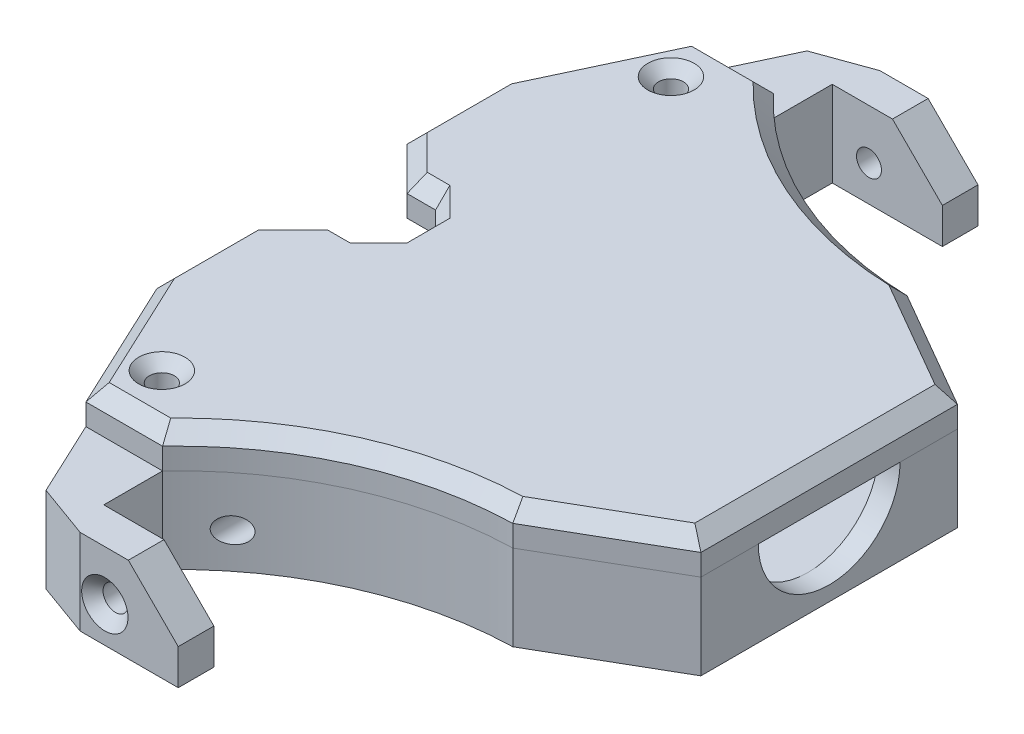
from build123d import *
from OCP.BRepFilletAPI import BRepFilletAPI_MakeChamfer

# Parameters (mm, degrees)
BOSS_EXTRUDE1_DEPTH     = 2
BOSS_EXTRUDE2_DEPTH     = 10
BOSS_EXTRUDE3_START     = -10
BOSS_EXTRUDE3_DEPTH     = 10
SKETCH4_4_W             = 12.534166667
SKETCH4_4_H             = 17.5
CUT_EXTRUDE3_DEPTH      = 10
CUT_EXTRUDE4_DEPTH      = 112.520919575
CHAMFER1_SIZE           = 3
CHAMFER1_SIZE2          = 8.242432258
BOSS_EXTRUDE4_DEPTH     = 19.55
SKETCH9_W               = 19.55
SKETCH9_H               = 12
BOSS_EXTRUDE5_DEPTH     = 8.25
SKETCH10_W              = 19.55
SKETCH10_H              = 12
BOSS_EXTRUDE6_DEPTH     = 8.25
SKETCH11_W              = 35
SKETCH11_H              = 12
BOSS_EXTRUDE7_DEPTH     = 5
SKETCH12_W              = 35
SKETCH12_H              = 12
BOSS_EXTRUDE8_DEPTH     = 5
CUT_EXTRUDE6_DEPTH      = 112.897788575
CHAMFER2_SIZE           = 3
CHAMFER2_SIZE2          = 6.236681311
CHAMFER3_SIZE           = 7
CUT_EXTRUDE7_DEPTH      = 120.143501803
CUT_EXTRUDE7_DEPTH_BACK = 120.143501803
SKETCH14_R              = 1.75
CUT_EXTRUDE8_REACH      = 110.526
SKETCH15_R              = 1.5
CHAMFER5_SIZE           = 1
CUT_EXTRUDE9_DEPTH      = 3
BOSS_EXTRUDE9_DEPTH     = 5
CHAMFER6_SIZE           = 2
CUT_EXTRUDE10_START     = -17
SKETCH18_R              = 1.75
CUT_EXTRUDE10_DEPTH     = 17
CHAMFER7_SIZE           = 1.5
SKETCH23_R              = 1.75
CUT_EXTRUDE15_DEPTH     = 2.35
CUT_EXTRUDE16_START     = -5
CUT_EXTRUDE16_OUTLINE_W = 12
CUT_EXTRUDE16_OUTLINE_H = 10
CUT_EXTRUDE16_DEPTH     = 5
CHAMFER8_SIZE           = 2
CHAMFER11_SIZE          = 1.5
CUT_EXTRUDE17_DEPTH     = 2.4
CHAMFER12_SIZE          = 6
CHAMFER13_SIZE          = 2


# Read off the part's stored shape, not the designer's step: Cut-Extrude16
with BuildPart() as part:
    # Sketch2 → Boss-Extrude1 (new body)
    with BuildSketch(Plane(origin=(0, 0, 0), x_dir=(1, 0, 0), z_dir=(0, 1, 0))):
        with BuildLine():
            Line((-0.145833333, 85.863132769), (-0.145833333, 0.136867231))
            ThreePointArc((-0.145833333, 0.136867231), (35, 15.351864589), (70.145833333, 0.136867231))
            Line((70.145833333, 0.136867231), (70.145833333, 85.863132769))
            ThreePointArc((70.145833333, 85.863132769), (35, 70.648135411), (-0.145833333, 85.863132769))
        make_face()
    extrude(amount=BOSS_EXTRUDE1_DEPTH)

    # Sketch3 → Boss-Extrude2 (add)
    with BuildSketch(Plane(origin=(0, 2, 0), x_dir=(1, 0, 0), z_dir=(0, 1, 0))):
        with BuildLine():
            ThreePointArc((-0.145833333, 73.719315359), (16.41947938, 64.750036984), (35, 61.648135411))
            Line((35, 61.648135411), (35, 24.351864589))
            ThreePointArc((35, 24.351864589), (16.41947938, 21.249963016), (-0.145833333, 12.280684641))
            Line((-0.145833333, 12.280684641), (-0.145833333, 0.136867231))
            ThreePointArc((-0.145833333, 0.136867231), (35, 15.351864589), (70.145833333, 0.136867231))
            Line((70.145833333, 0.136867231), (70.145833333, 85.863132769))
            ThreePointArc((70.145833333, 85.863132769), (35, 70.648135411), (-0.145833333, 85.863132769))
            Line((-0.145833333, 85.863132769), (-0.145833333, 73.719315359))
        make_face()
    extrude(amount=BOSS_EXTRUDE2_DEPTH)

    # Sketch4 → Boss-Extrude3 (add)
    with BuildSketch(Plane(origin=(0, 12, 0), x_dir=(1, 0, 0), z_dir=(0, 1, 0)).offset(BOSS_EXTRUDE3_START)):
        with BuildLine():
            Line((29.534166667, 61.909882312), (29.534166667, 53.05))
            Line((29.534166667, 53.05), (32.534166667, 53.05))
            Line((32.534166667, 53.05), (32.534166667, 60.5))
            Line((32.534166667, 60.5), (35, 60.5))
            Line((35, 60.5), (35, 61.648135411))
            ThreePointArc((35, 61.648135411), (32.263951505, 61.713609609), (29.534166667, 61.909882312))
        make_face()
        with BuildLine():
            Line((25.754166667, 53.05), (25.754166667, 62.400331504))
            ThreePointArc((25.754166667, 62.400331504), (24.300603689, 62.657718803), (22.854166667, 62.952529746))
            Line((22.854166667, 62.952529746), (22.854166667, 53.05))
            Line((22.854166667, 53.05), (25.754166667, 53.05))
        make_face()
        with BuildLine():
            Line((35, 24.351864589), (35, 25.5))
            Line((35, 25.5), (32.534166667, 25.5))
            Line((32.534166667, 25.5), (32.534166667, 32.95))
            Line((32.534166667, 32.95), (29.534166667, 32.95))
            Line((29.534166667, 32.95), (29.534166667, 24.090117688))
            ThreePointArc((29.534166667, 24.090117688), (32.263951505, 24.286390391), (35, 24.351864589))
        make_face()
        with BuildLine():
            ThreePointArc((22.854166667, 23.047470254), (24.300603689, 23.342281197), (25.754166667, 23.599668496))
            Line((25.754166667, 23.599668496), (25.754166667, 32.95))
            Line((25.754166667, 32.95), (22.854166667, 32.95))
            Line((22.854166667, 32.95), (22.854166667, 23.047470254))
        make_face()
    extrude(amount=BOSS_EXTRUDE3_DEPTH)

    # Sketch4<4> → Cut-Extrude3 (cut)
    with BuildSketch(Plane(origin=(0, 12, 0), x_dir=(1, 0, 0), z_dir=(0, 1, 0))):
        with Locations((41.267083333, 51.75)):
            Rectangle(SKETCH4_4_W, SKETCH4_4_H)
        with Locations((41.267083333, 34.25)):
            Rectangle(SKETCH4_4_W, SKETCH4_4_H)
    extrude(amount=-CUT_EXTRUDE3_DEPTH, mode=Mode.SUBTRACT)

    # Sketch6 → Cut-Extrude4 (cut, through all)
    with BuildSketch(Plane(origin=(0, 12, 0), x_dir=(1, 0, 0), z_dir=(0, 1, 0))):
        with BuildLine():
            Line((33.797103893, 70.663147698), (50.534166667, 61))
            Line((50.534166667, 61), (50.534166667, 25))
            Line((50.534166667, 25), (33.797103893, 15.336852302))
            ThreePointArc((33.797103893, 15.336852302), (53.595446578, 11.620385663), (70.145833333, 0.136867231))
            Line((70.145833333, 0.136867231), (70.145833333, 85.863132769))
            ThreePointArc((70.145833333, 85.863132769), (53.595446578, 74.379614337), (33.797103893, 70.663147698))
        make_face()
    extrude(amount=-CUT_EXTRUDE4_DEPTH, mode=Mode.SUBTRACT)

    # Chamfer1
    chamfer1_edges = [part.edges().sort_by_distance(p)[0] for p in [
        (47.534166667, 7, -60.5),
        (47.534166667, 7, -25.5),
    ]]
    chamfer1_side = [part.faces().sort_by_distance(p)[0] for p in [
        (47.534166667, 7, -43),
    ]]
    chamfer(chamfer1_edges, length=CHAMFER1_SIZE, length2=CHAMFER1_SIZE2, reference=chamfer1_side[0])

    # Sketch7 → Boss-Extrude4 (add)
    with BuildSketch(Plane.ZY.offset(0.145833333)):
        Polygon((-85.863132769, 0), (-0.136867231, 0), (-0.136867231, 12), (-12.280684641, 12), (-12.280684641, 2), (-73.719315359, 2), (-73.719315359, 12), (-85.863132769, 12), align=None)
    extrude(amount=BOSS_EXTRUDE4_DEPTH)

    # Sketch9 → Boss-Extrude5 (add)
    with BuildSketch(Plane(origin=(0, 0, -85.863132769), x_dir=(-1, 0, 0), z_dir=(0, 0, -1))):
        with Locations((9.920833333, 6)):
            Rectangle(SKETCH9_W, SKETCH9_H)
    extrude(amount=BOSS_EXTRUDE5_DEPTH)

    # Sketch10 → Boss-Extrude6 (add)
    with BuildSketch(Plane.XY.offset(-0.136867231)):
        with Locations((-9.920833333, 6)):
            Rectangle(SKETCH10_W, SKETCH10_H)
    extrude(amount=BOSS_EXTRUDE6_DEPTH)

    # Sketch11 → Boss-Extrude7 (add)
    with BuildSketch(Plane.XY.offset(8.113132769)):
        with Locations((-2.195833333, 6)):
            Rectangle(SKETCH11_W, SKETCH11_H)
    extrude(amount=BOSS_EXTRUDE7_DEPTH)

    # Sketch12 → Boss-Extrude8 (add)
    with BuildSketch(Plane(origin=(0, 0, -94.113132769), x_dir=(-1, 0, 0), z_dir=(0, 0, -1))):
        with Locations((2.195833333, 6)):
            Rectangle(SKETCH12_W, SKETCH12_H)
    extrude(amount=BOSS_EXTRUDE8_DEPTH)

    # Sketch13 → Cut-Extrude6 (cut, through all)
    with BuildSketch(Plane.XZ):
        Polygon((-19.695833333, -18.886867231), (-4.695833333, 13.113132769), (-19.695833333, 13.113132769), align=None)
        Polygon((-4.695833333, -99.113132769), (-19.695833333, -67.113132769), (-19.695833333, -99.113132769), align=None)
    extrude(amount=-CUT_EXTRUDE6_DEPTH, mode=Mode.SUBTRACT)

    # Chamfer2: one chamfer whose edges measure the first distance from different faces: ONE call of the kernel's chamfer builder (chamfer() names one face for all edges)
    chamfer2_edges_1 = [part.edges().sort_by_distance(p)[0] for p in [
        (-4.695833333, 6, 13.113132769),
    ]]
    chamfer2_side_1 = [part.faces().sort_by_distance(p)[0] for p in [
        (-10.959182271, 5.792218012, -0.248678298),
    ]]
    chamfer2_edges_2 = [part.edges().sort_by_distance(p)[0] for p in [
        (-4.695833333, 6, -99.113132769),
    ]]
    chamfer2_side_2 = [part.faces().sort_by_distance(p)[0] for p in [
        (-10.959182271, 5.792218012, -85.751321702),
    ]]
    chamfer2 = BRepFilletAPI_MakeChamfer(part.part.solid().wrapped)
    for e in chamfer2_edges_1:
        chamfer2.Add(CHAMFER2_SIZE, CHAMFER2_SIZE2, e.wrapped, chamfer2_side_1[0].wrapped)  # the first distance lies on this face
    for e in chamfer2_edges_2:
        chamfer2.Add(CHAMFER2_SIZE, CHAMFER2_SIZE2, e.wrapped, chamfer2_side_2[0].wrapped)  # the first distance lies on this face
    add(Compound.cast(chamfer2.Shape()), mode=Mode.REPLACE)

    # Chamfer3
    chamfer3_edges = [part.edges().sort_by_distance(p)[0] for p in [
        (15.304166667, 12, 10.613132769),
        (15.304166667, 12, -96.613132769),
    ]]
    chamfer(chamfer3_edges, length=CHAMFER3_SIZE)

    # Sketch14 → Cut-Extrude7 (cut, two sides: drawn at the far end of the back side and taken through both)
    with BuildSketch(Plane(origin=(0, 0, 8.113132769), x_dir=(-1, 0, 0), z_dir=(0, 0, -1)).offset(-CUT_EXTRUDE7_DEPTH_BACK)):
        with Locations((-5.004166667, 5)):
            Circle(SKETCH14_R)
    extrude(amount=CUT_EXTRUDE7_DEPTH + CUT_EXTRUDE7_DEPTH_BACK, mode=Mode.SUBTRACT)

    # Cut-Extrude8: up to this face of the body (flat: up to its plane)
    cut_extrude8_end = Plane(part.part.faces().sort_by_distance((32.534166667, 7, -56.775))[0])
    # Sketch15 → Cut-Extrude8 (cut, up to the picked face)
    with BuildSketch(Plane.ZY.offset(-22.854166667), mode=Mode.PRIVATE) as cut_extrude8_sk1:
        with Locations(Location((-56, 7, 0), (0, 0, 180))):
            Circle(SKETCH15_R)
    cut_extrude8_tool1 = split(extrude(cut_extrude8_sk1.sketch, amount=-CUT_EXTRUDE8_REACH, mode=Mode.PRIVATE), bisect_by=cut_extrude8_end, keep=Keep.BOTH, mode=Mode.PRIVATE)
    # Sketch15 → Cut-Extrude8 (cut, up to the picked face)
    with BuildSketch(Plane.ZY.offset(-22.854166667), mode=Mode.PRIVATE) as cut_extrude8_sk2:
        with Locations((-30, 7)):
            Circle(SKETCH15_R)
    cut_extrude8_tool2 = split(extrude(cut_extrude8_sk2.sketch, amount=-CUT_EXTRUDE8_REACH, mode=Mode.PRIVATE), bisect_by=cut_extrude8_end, keep=Keep.BOTH, mode=Mode.PRIVATE)
    add(cut_extrude8_tool1.solids().sort_by(Axis((22.854167, 7, -56), (1, 0, 0)))[0], mode=Mode.SUBTRACT)
    add(cut_extrude8_tool2.solids().sort_by(Axis((22.854167, 7, -30), (1, 0, 0)))[0], mode=Mode.SUBTRACT)

    # Chamfer5
    chamfer5_edges = [part.edges().sort_by_distance(p)[0] for p in [
        (22.854166667, 7, -54.5),
        (22.854166667, 7, -31.5),
    ]]
    chamfer(chamfer5_edges, length=CHAMFER5_SIZE)

    # Sketch16 → Cut-Extrude9 (cut)
    with BuildSketch(Plane.ZY.offset(-47.534166667)):
        with BuildLine():
            Line((-33.05, 12), (-52.95, 12))
            ThreePointArc((-52.95, 12), (-43, 2.05), (-33.05, 12))
        make_face()
    extrude(amount=-CUT_EXTRUDE9_DEPTH, mode=Mode.SUBTRACT)


with BuildPart() as body_2:
    # Sketch17 → Boss-Extrude9 (new body)
    with BuildSketch(Plane(origin=(0, 12, 0), x_dir=(1, 0, 0), z_dir=(0, 1, 0))):
        with BuildLine():
            Line((-19.695833333, 67.113132769), (-19.695833333, 18.886867231))
            Line((-19.695833333, 18.886867231), (-16.599185244, 12.280684641))
            Line((-16.599185244, 12.280684641), (-10.906770833, 0.136867231))
            Line((-10.906770833, 0.136867231), (-0.145833333, 0.136867231))
            ThreePointArc((-0.145833333, 0.136867231), (15.300573117, 11.142461089), (33.797103893, 15.336852302))
            Line((33.797103893, 15.336852302), (50.534166667, 25))
            Line((50.534166667, 25), (50.534166667, 33.05))
            Line((50.534166667, 33.05), (50.534166667, 52.95))
            Line((50.534166667, 52.95), (50.534166667, 61))
            Line((50.534166667, 61), (33.797103893, 70.663147698))
            ThreePointArc((33.797103893, 70.663147698), (15.300573117, 74.857538911), (-0.145833333, 85.863132769))
            Line((-0.145833333, 85.863132769), (-10.906770833, 85.863132769))
            Line((-10.906770833, 85.863132769), (-16.599185244, 73.719315359))
            Line((-16.599185244, 73.719315359), (-19.695833333, 67.113132769))
        make_face()
    extrude(amount=BOSS_EXTRUDE9_DEPTH)

    # Chamfer6
    chamfer6_edges = [body_2.edges().sort_by_distance(p)[0] for p in [
        (-5.526302083, 17, -0.136867231),
        (15.300573117, 17, -11.142461089),
        (42.16563528, 17, -20.168426151),
        (50.534166667, 17, -43),
        (42.16563528, 17, -65.831573849),
        (15.300573117, 17, -74.857538911),
        (-5.526302083, 17, -85.863132769),
        (-15.301302083, 17, -9.511867231),
        (-15.301302083, 17, -76.488132769),
        (-19.695833333, 17, -43),
    ]]
    chamfer(chamfer6_edges, length=CHAMFER6_SIZE)


with BuildPart() as cut_extrude10_tool:
    # Sketch18 → Cut-Extrude10 (new body)
    with BuildSketch(Plane(origin=(0, 17, 0), x_dir=(1, 0, 0), z_dir=(0, 1, 0)).offset(CUT_EXTRUDE10_START)):
        with Locations(Location((-7.390360613, 78.719315359, 0), (0, 0, 270))):
            Circle(SKETCH18_R)
        with Locations(Location((-7.390360613, 7.280684641, 0), (0, 0, 270))):
            Circle(SKETCH18_R)
    extrude(amount=CUT_EXTRUDE10_DEPTH)


with BuildPart() as part_1:
    add(part.part)

    # Cut-Extrude10: cut by cut_extrude10_tool
    add(cut_extrude10_tool.part, mode=Mode.SUBTRACT)

    # Sketch23 → Cut-Extrude15 (cut)
    # profile 1 of 2: a face of its own
    with BuildSketch(Plane.XZ):
        Polygon((-4.615360613, -8.882831638), (-4.615360613, -5.678537644), (-7.390360613, -4.076390647), (-10.165360613, -5.678537644), (-10.165360613, -8.882831638), (-7.390360613, -10.484978635), align=None)
        with Locations(Location((-7.390360613, -7.280684641, 0), (0, 0, 90))):
            Circle(SKETCH23_R, mode=Mode.SUBTRACT)
    # profile 2 of 2: a face of its own
    with BuildSketch(Plane.XZ):
        Polygon((-4.615360613, -80.321462356), (-4.615360613, -77.117168362), (-7.390360613, -75.515021365), (-10.165360613, -77.117168362), (-10.165360613, -80.321462356), (-7.390360613, -81.923609353), align=None)
        with Locations(Location((-7.390360613, -78.719315359, 0), (0, 0, 90))):
            Circle(SKETCH23_R, mode=Mode.SUBTRACT)
    extrude(amount=-CUT_EXTRUDE15_DEPTH, mode=Mode.SUBTRACT)

    # Chamfer11
    chamfer11_edges = [part_1.edges().sort_by_distance(p)[0] for p in [
        (6.754166667, 5, 13.113132769),
        (6.754166667, 5, -99.113132769),
    ]]
    chamfer(chamfer11_edges, length=CHAMFER11_SIZE)

    # Sketch25 → Cut-Extrude17 (cut)
    with BuildSketch(Plane.XY.offset(-73.719315359)):
        Polygon((8.208460661, 12), (8.208460661, 5), (6.606313664, 7.775), (3.40201967, 7.775), (1.799872673, 5), (1.799872673, 12), align=None)
        Polygon((6.606313664, 7.775), (3.40201967, 7.775), (1.799872673, 5), (3.40201967, 2.225), (6.606313664, 2.225), (8.208460661, 5), align=None)
    cut_extrude17 = extrude(amount=-CUT_EXTRUDE17_DEPTH, mode=Mode.SUBTRACT)

    # Mirror1: Cut-Extrude17 across plane
    add(cut_extrude17.mirror(Plane.XY.offset(-43)), mode=Mode.SUBTRACT)


with BuildPart() as body_2_1:
    add(body_2.part)

    # Cut-Extrude10: cut by cut_extrude10_tool
    add(cut_extrude10_tool.part, mode=Mode.SUBTRACT)

    # Chamfer7
    chamfer7_edges = [body_2_1.edges().sort_by_distance(p)[0] for p in [
        (-7.390360613, 17, -80.469315359),
        (-7.390360613, 17, -9.030684641),
    ]]
    chamfer(chamfer7_edges, length=CHAMFER7_SIZE)

    # Cut-Extrude16 outline → Cut-Extrude16 (cut)
    with BuildSketch(Plane(origin=(0, 17, 0), x_dir=(1, 0, 0), z_dir=(0, 1, 0)).offset(CUT_EXTRUDE16_START)):
        with Locations((-13.695833333, 43)):
            Rectangle(CUT_EXTRUDE16_OUTLINE_W, CUT_EXTRUDE16_OUTLINE_H)
    extrude(amount=CUT_EXTRUDE16_DEPTH, mode=Mode.SUBTRACT)

    # Chamfer8
    chamfer8_edges = [body_2_1.edges().sort_by_distance(p)[0] for p in [
        (-7.695833333, 14.5, -38),
        (-7.695833333, 14.5, -48),
        (-12.695833333, 17, -38),
        (-7.695833333, 17, -43),
        (-12.695833333, 17, -48),
    ]]
    chamfer(chamfer8_edges, length=CHAMFER8_SIZE)

    # Chamfer12
    # the kernel refuses this chamfer: 6 mm, written as the material it takes off along each edge
    with BuildSketch(Plane(origin=(-19.695833333, -3.430097928, -38), x_dir=(-0.027495876610586206, 0, 0.9996219169112968), z_dir=(0, 1, 0)), Plane(origin=(-19.695833333, -3.430097928, -48), x_dir=(0.9996219169112968, 0, 0.027495876610586775), z_dir=(0, 1, 0))) as chamfer12_piece_1:
        Polygon((CHAMFER12_SIZE * 0.999621916911, CHAMFER12_SIZE * 0.0274958766106), (-CHAMFER12_SIZE * 0.0274958766106, CHAMFER12_SIZE * 0.999621916911), (0, 0), align=None)
    extrude(amount=33.860195856, mode=Mode.SUBTRACT)

    # Chamfer13
    chamfer13_edges = [body_2_1.edges().sort_by_distance(p)[0] for p in [
        (-16.695833333, 17, -35),
        (-16.695833333, 17, -51),
    ]]
    chamfer(chamfer13_edges, length=CHAMFER13_SIZE)


solid = Compound([part_1.part, body_2_1.part])
